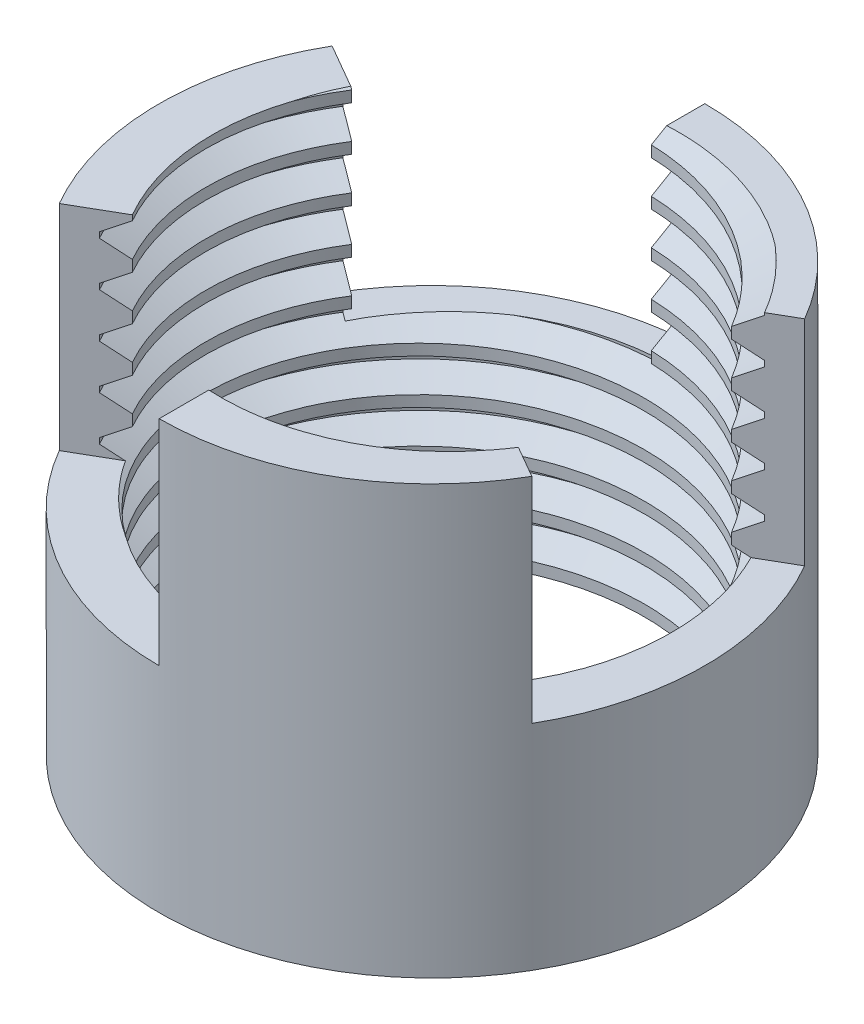
from build123d import *

# Parameters (mm, degrees)
SKETCH1_W          = 1.5
SKETCH1_H          = 12
THREAD1_PITCH      = 1.25
CUT_EXTRUDE1_START = -6
CUT_EXTRUDE1_DEPTH = 6
CIRPATTERN1_COUNT  = 3


with BuildPart() as part:
    # Sketch1 → Revolve1 (revolve)
    with BuildSketch(Plane(origin=(0, 0, 0), x_dir=(0, 0, -1), z_dir=(1, 0, 0))):
        with Locations((6.9, 6)):
            Rectangle(SKETCH1_W, SKETCH1_H)
    revolve(axis=Axis((0, 0, 0), (0, 1, 0)))

    # Thread1: the profile of Thread Profile1 profile screwed along a right-hand helix of 11.2 turns, 8 arcs to a turn; built about Z, then put on its axis
    thread1_z = Axis((0, 0, 0), (0, 0, 1))
    thread1_corners = [(6.1497, 0, -0.000173205), (6.826582344, 0, 0.390624998), (6.826582344, 0, 0.546874998), (6.1497, 0, 0.937673202)]
    with BuildLine(mode=Mode.PRIVATE) as thread1_profile:
        Line(thread1_corners[0], thread1_corners[1])
        Line(thread1_corners[1], thread1_corners[2])
        Line(thread1_corners[2], thread1_corners[3])
        Line(thread1_corners[3], thread1_corners[0])
    thread1_cap = Face(thread1_profile.wire())
    thread1_turn_angles = [0, 22.5, 45, 67.5, 90, 112.5, 135, 157.5, 180, 202.5, 225, 247.5, 270, 292.5, 315, 337.5, 360]
    thread1_turn_weights = [1, 0.9238795325112867, 1, 0.9238795325112867, 1, 0.9238795325112867, 1, 0.9238795325112867, 1, 0.9238795325112867, 1, 0.9238795325112867, 1, 0.9238795325112867, 1, 0.9238795325112867, 1]
    thread1_turn_rails = [Edge.make_bspline([Vector(p[0], p[1], 0).rotate(thread1_z, thread1_turn_angles[k]) / thread1_turn_weights[k] + Vector(0, 0, p[2] + THREAD1_PITCH * thread1_turn_angles[k] / 360) for k in range(17)], [0, 0, 0, 1, 1, 2, 2, 3, 3, 4, 4, 5, 5, 6, 6, 7, 7, 8, 8, 8], 2, thread1_turn_weights) for p in thread1_corners]
    thread1_turn_sides = [Face.make_surface_from_curves(thread1_turn_rails[p[0]], thread1_turn_rails[p[1]]) for p in [(0, 1), (1, 2), (2, 3), (3, 0)]]
    thread1_last_angles = [3960, 3982.5, 4005, 4018.5, 4032]
    thread1_last_weights = [1, 0.9238795325112867, 1, 0.9723699203976766, 1]
    thread1_last_rails = [Edge.make_bspline([Vector(p[0], p[1], 0).rotate(thread1_z, thread1_last_angles[k]) / thread1_last_weights[k] + Vector(0, 0, p[2] + THREAD1_PITCH * thread1_last_angles[k] / 360) for k in range(5)], [0, 0, 0, 1, 1, 2, 2, 2], 2, thread1_last_weights) for p in thread1_corners]
    thread1_last_sides = [Face.make_surface_from_curves(thread1_last_rails[p[0]], thread1_last_rails[p[1]]) for p in [(0, 1), (1, 2), (2, 3), (3, 0)]]
    thread1 = Plane(origin=(0, 13, 0), x_dir=(-1, 0, 0), z_dir=(0, -1, 0)) * Solid(Shell([*[p.moved(Location((0, 0, THREAD1_PITCH * i))) for i in range(11) for p in thread1_turn_sides], *thread1_last_sides, thread1_cap, thread1_cap.rotate(thread1_z, 4032).moved(Location((0, 0, THREAD1_PITCH * 4032 / 360)))]))
    add(thread1, mode=Mode.SUBTRACT)

    # Sketch4 → Cut-Extrude1 (cut)
    with BuildSketch(Plane(origin=(0, 12, 0), x_dir=(1, 0, 0), z_dir=(0, 1, 0)).offset(CUT_EXTRUDE1_START)):
        with BuildLine():
            Line((-6.625094339, 3.825), (-5.326056233, 3.075))
            ThreePointArc((-5.326056233, 3.075), (-3.075, 5.326056233), (0, 6.15))
            Line((0, 6.15), (0, 7.65))
            ThreePointArc((0, 7.65), (-3.825, 6.625094339), (-6.625094339, 3.825))
        make_face()
    cut_extrude1 = extrude(amount=CUT_EXTRUDE1_DEPTH, mode=Mode.SUBTRACT)

    # CirPattern1: Cut-Extrude1 ×3 about axis
    cirpattern1_axis = Axis((0, 0, 0), (0, 1, 0))
    for i in range(1, CIRPATTERN1_COUNT):
        add(cut_extrude1.rotate(cirpattern1_axis, i * 360 / CIRPATTERN1_COUNT), mode=Mode.SUBTRACT)


solid = part.part
